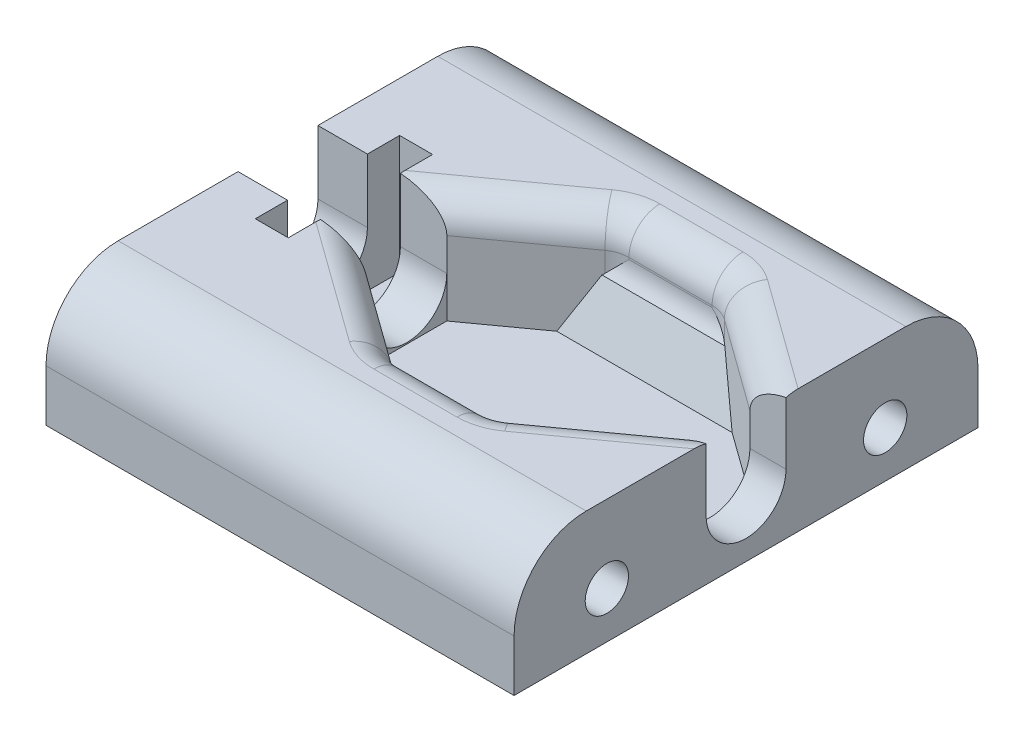
from build123d import *

# Parameters (mm, degrees)
SKETCH1_W                = 218
SKETCH1_H                = 45
BOSS_EXTRUDE1_DEPTH      = 42
SKETCH7_W                = 118.2
SKETCH7_H                = 42
CUT_EXTRUDE17_DEPTH      = 21
SKETCH4_W                = 7.75
SKETCH4_H                = 6.175
CUT_EXTRUDE14_DEPTH      = 97.8
SKETCH5_R                = 3.875
CUT_EXTRUDE15_DEPTH      = 97.8
SKETCH11_W               = 3.2
SKETCH11_H               = 14
CUT_EXTRUDE19_DEPTH      = 11.5
CUT_EXTRUDE43_DEPTH      = 7
SKETCH53_R               = 2.1
CUT_EXTRUDE44_DEPTH      = 95
SKETCH68_R               = 2.65
CUT_EXTRUDE57_DEPTH      = 28.3
BOSS_EXTRUDE2_DEPTH      = 5
SKETCH42_W               = 80.5
SKETCH42_H               = 9.5
BOSS_EXTRUDE3_DEPTH      = 35
SKETCH38_R               = 3.1
CUT_EXTRUDE32_DEPTH      = 4.7
SKETCH40_R               = 5.5
CUT_EXTRUDE34_DEPTH      = 9
SKETCH41_R               = 5.75
CUT_EXTRUDE35_DEPTH      = 4
FILLET1_R                = 7
FILLET7_R                = 5
SKETCH47_R               = 1.5
CUT_EXTRUDE39_DEPTH      = 7
SKETCH49_R               = 2.8
CUT_EXTRUDE41_DEPTH      = 33
SKETCH56_W               = 15.8
SKETCH56_H               = 10.4
CUT_EXTRUDE47_DEPTH      = 32.15
SKETCH57_W               = 5
SKETCH57_H               = 10.4
CUT_EXTRUDE48_DEPTH      = 15
SKETCH58_R               = 2.8
SKETCH58_R_2             = 2.05
CUT_EXTRUDE49_DEPTH      = 10
SKETCH59_R               = 1.5
SKETCH59_R_2             = 0.95
CUT_EXTRUDE50_DEPTH      = 6.5
CUT_EXTRUDE51_START      = -9
CUT_EXTRUDE51_DEPTH      = 9
CUT_EXTRUDE52_DEPTH      = 118.2
SKETCH64_R               = 1.5
CUT_EXTRUDE53_DEPTH      = 14
SKETCH65_R               = 2.8
CUT_EXTRUDE54_DEPTH      = 9.95
SKETCH66_R               = 1.5
CUT_EXTRUDE55_DEPTH      = 25
SKETCH67_R               = 1.45
CUT_EXTRUDE56_DEPTH      = 7
CUT_EXTRUDE58_START      = -4
SKETCH69_R               = 2.8
CUT_EXTRUDE58_DEPTH      = 41
CUT_EXTRUDE59_DEPTH      = 6.175
FILLET17_R               = 3
CUT_EXTRUDE64_DEPTH      = 4
FILLET19_R               = 3
CUT_EXTRUDE65_DEPTH      = 4
CUT_EXTRUDE61_DEPTH      = 1
CUT_EXTRUDE61_DEPTH_BACK = 221.034656475
SKETCH72_W               = 64
SKETCH72_H               = 35
SKETCH74_W               = 118.2
SKETCH74_H               = 64
CUT_EXTRUDE62_DEPTH      = 226.02944262
SKETCH81_W               = 45.4
SKETCH81_H               = 45
CUT_EXTRUDE66_DEPTH      = 12


with BuildPart() as part:
    # Sketch1 → Boss-Extrude1 (new body)
    with BuildSketch(Plane(origin=(0, 0, 0), x_dir=(1, 0, 0), z_dir=(0, 1, 0))):
        with Locations((109, 22.5)):
            Rectangle(SKETCH1_W, SKETCH1_H)
    extrude(amount=BOSS_EXTRUDE1_DEPTH)

    # Sketch7 → Cut-Extrude17 (cut)
    with BuildSketch(Plane(origin=(0, 42, 0), x_dir=(1, 0, 0), z_dir=(0, 1, 0))):
        with Locations((68.1, 22.5)):
            Rectangle(SKETCH7_W, SKETCH7_H)
    extrude(amount=-CUT_EXTRUDE17_DEPTH, mode=Mode.SUBTRACT)

    # Sketch4 → Cut-Extrude14 (cut)
    with BuildSketch(Plane(origin=(218, 0, 0), x_dir=(0, 0, -1), z_dir=(1, 0, 0))):
        with Locations((22.5, 38.9125)):
            Rectangle(SKETCH4_W, SKETCH4_H)
    extrude(amount=-CUT_EXTRUDE14_DEPTH, mode=Mode.SUBTRACT)

    # Sketch5 → Cut-Extrude15 (cut)
    with BuildSketch(Plane(origin=(218, 0, 0), x_dir=(0, 0, -1), z_dir=(1, 0, 0))):
        with Locations((22.5, 35.825)):
            Circle(SKETCH5_R)
    extrude(amount=-CUT_EXTRUDE15_DEPTH, mode=Mode.SUBTRACT)

    # Sketch11 → Cut-Extrude19 (cut)
    with BuildSketch(Plane(origin=(0, 42, 0), x_dir=(1, 0, 0), z_dir=(0, 1, 0))):
        with Locations((133.6, 22.5)):
            Rectangle(SKETCH11_W, SKETCH11_H)
    extrude(amount=-CUT_EXTRUDE19_DEPTH, mode=Mode.SUBTRACT)

    # Sketch52 → Cut-Extrude43 (cut)
    with BuildSketch(Plane(origin=(218, 0, 0), x_dir=(0, 0, -1), z_dir=(1, 0, 0))):
        with BuildLine():
            Line((17.475, 42), (17.475, 35.825))
            ThreePointArc((17.475, 35.825), (22.5, 30.8), (27.525, 35.825))
            Line((27.525, 35.825), (27.525, 42))
            Line((27.525, 42), (17.475, 42))
        make_face()
    extrude(amount=-CUT_EXTRUDE43_DEPTH, mode=Mode.SUBTRACT)

    # Sketch53 → Cut-Extrude44 (cut)
    with BuildSketch(Plane(origin=(218, 0, 0), x_dir=(0, 0, -1), z_dir=(1, 0, 0))):
        with Locations((9, 34.5)):
            Circle(SKETCH53_R)
        with Locations((36, 34.5)):
            Circle(SKETCH53_R)
    extrude(amount=-CUT_EXTRUDE44_DEPTH, mode=Mode.SUBTRACT)

    # Sketch68 → Cut-Extrude57 (cut)
    with BuildSketch(Plane.ZY.offset(-127.2)):
        with Locations((-9, 34.5)):
            Circle(SKETCH68_R)
        with Locations((-36, 34.5)):
            Circle(SKETCH68_R)
    extrude(amount=-CUT_EXTRUDE57_DEPTH, mode=Mode.SUBTRACT)

    # Sketch14 → Boss-Extrude2 (add)
    with BuildSketch(Plane.XZ):
        Polygon((9, -54.5), (89.5, -54.5), (89.5, -45), (218, -45), (218, 0), (89.5, 0), (89.5, 9.5), (9, 9.5), (9, 0), (0, 0), (0, -45), (9, -45), align=None)
    extrude(amount=BOSS_EXTRUDE2_DEPTH)

    # Sketch42 → Boss-Extrude3 (add)
    with BuildSketch(Plane(origin=(0, 0, 0), x_dir=(1, 0, 0), z_dir=(0, 1, 0))):
        with Locations((49.25, -4.75)):
            Rectangle(SKETCH42_W, SKETCH42_H)
        with Locations((49.25, 49.75)):
            Rectangle(SKETCH42_W, SKETCH42_H)
    extrude(amount=BOSS_EXTRUDE3_DEPTH)

    # Sketch38 → Cut-Extrude32 (cut)
    with BuildSketch(Plane(origin=(127.2, -5, -22.5), x_dir=(0, 0, -1), z_dir=(0, -1, 0))):
        with Locations((23.5, -61.2)):
            Circle(SKETCH38_R)
        with Locations((10, -61.2)):
            Circle(SKETCH38_R)
    extrude(amount=-CUT_EXTRUDE32_DEPTH, mode=Mode.SUBTRACT)

    # Sketch40 → Cut-Extrude34 (cut)
    with BuildSketch(Plane(origin=(127.2, -5, -22.5), x_dir=(0, 0, -1), z_dir=(0, -1, 0))):
        with Locations((0, -33.7)):
            Circle(SKETCH40_R)
    extrude(amount=-CUT_EXTRUDE34_DEPTH, mode=Mode.SUBTRACT)

    # Sketch41 → Cut-Extrude35 (cut)
    with BuildSketch(Plane(origin=(127.2, -5, -22.5), x_dir=(0, 0, -1), z_dir=(0, -1, 0))):
        with Locations((20, -73.2)):
            Circle(SKETCH41_R)
        with Locations((-20, -73.2)):
            Circle(SKETCH41_R)
    extrude(amount=-CUT_EXTRUDE35_DEPTH, mode=Mode.SUBTRACT)

    # Fillet1
    # the kernel refuses this fillet: 7 mm, written as the material it takes off along each edge
    with BuildSketch(Plane(origin=(235.5, 42, -45), x_dir=(0, 0, 1), z_dir=(-1, 0, 0))) as fillet1_piece_1:
        with BuildLine():
            CenterArc((FILLET1_R, -FILLET1_R), FILLET1_R, 90, 90)
            Line((0, -FILLET1_R), (0, 0))
            Line((0, 0), (FILLET1_R, 0))
        make_face()
    extrude(amount=253, mode=Mode.SUBTRACT)
    with BuildSketch(Plane(origin=(-17.5, 42, 0), x_dir=(0, -1, 0), z_dir=(1, 0, 0))) as fillet1_piece_2:
        with BuildLine():
            CenterArc((FILLET1_R, FILLET1_R), FILLET1_R, 180, 90)
            Line((0, FILLET1_R), (0, 0))
            Line((0, 0), (FILLET1_R, 0))
        make_face()
    extrude(amount=253, mode=Mode.SUBTRACT)

    # Fillet7
    fillet7_edges = [part.edges().sort_by_distance(p)[0] for p in [
        (49.25, 35, -54.5),
        (49.25, 35, 9.5),
    ]]
    fillet(fillet7_edges, radius=FILLET7_R)

    # Sketch47 → Cut-Extrude39 (cut)
    with BuildSketch(Plane(origin=(127.2, -0.3, -22.5), x_dir=(0, 0, -1), z_dir=(0, -1, 0))):
        with Locations((23.5, -61.2)):
            Circle(SKETCH47_R)
        with Locations((10, -61.2)):
            Circle(SKETCH47_R)
    extrude(amount=-CUT_EXTRUDE39_DEPTH, mode=Mode.SUBTRACT)

    # Sketch49 → Cut-Extrude41 (cut)
    with BuildSketch(Plane.XZ.offset(-6.7)):
        with Locations(Location((66, -32.5, 0), (0, 0, 270))):
            Circle(SKETCH49_R)
        with Locations(Location((66, -46, 0), (0, 0, 270))):
            Circle(SKETCH49_R)
    extrude(amount=-CUT_EXTRUDE41_DEPTH, mode=Mode.SUBTRACT)

    # Sketch56 → Cut-Extrude47 (cut)
    with BuildSketch(Plane.XZ.offset(5)):
        with Locations((135.1, -14.2)):
            Rectangle(SKETCH56_W, SKETCH56_H)
    extrude(amount=-CUT_EXTRUDE47_DEPTH, mode=Mode.SUBTRACT)

    # Sketch57 → Cut-Extrude48 (cut)
    with BuildSketch(Plane.XZ.offset(5)):
        with Locations((124.7, -14.2)):
            Rectangle(SKETCH57_W, SKETCH57_H)
    extrude(amount=-CUT_EXTRUDE48_DEPTH, mode=Mode.SUBTRACT)

    # Sketch58 → Cut-Extrude49 (cut)
    with BuildSketch(Plane(origin=(127.2, 21, 0), x_dir=(0, -1, 0), z_dir=(0, 0, 1))):
        with Locations(Location((19.05, 2.8, 0), (0, 0, 90))):
            Circle(SKETCH58_R)
        with Locations(Location((10.15, 2.8, 0), (0, 0, 90))):
            Circle(SKETCH58_R_2)
        with BuildLine():
            Line((-2.632795978, 15.65), (-3.667204022, 15.65))
            ThreePointArc((-3.667204022, 15.65), (-5.85, 13), (-3.667204022, 10.35))
            Line((-3.667204022, 10.35), (-2.632795978, 10.35))
            ThreePointArc((-2.632795978, 10.35), (-0.45, 13), (-2.632795978, 15.65))
        make_face()
    extrude(amount=-CUT_EXTRUDE49_DEPTH, mode=Mode.SUBTRACT)

    # Sketch59 → Cut-Extrude50 (cut)
    with BuildSketch(Plane.XY.offset(-19.4)):
        with Locations((130, 1.95)):
            Circle(SKETCH59_R)
        with Locations((130, 10.85)):
            Circle(SKETCH59_R_2)
        with Locations((140.2, 24.15)):
            Circle(SKETCH59_R)
    extrude(amount=-CUT_EXTRUDE50_DEPTH, mode=Mode.SUBTRACT)

    # Sketch62 → Cut-Extrude51 (cut)
    with BuildSketch(Plane.ZY.offset(CUT_EXTRUDE51_START)):
        with BuildLine():
            Line((0, -5), (-45, -5))
            Line((-45, -5), (-45, 35))
            ThreePointArc((-45, 35), (-42.949747468, 39.949747468), (-38, 42))
            Line((-38, 42), (-7, 42))
            ThreePointArc((-7, 42), (-2.050252532, 39.949747468), (0, 35))
            Line((0, 35), (0, -5))
        make_face()
    extrude(amount=CUT_EXTRUDE51_DEPTH, mode=Mode.SUBTRACT)

    # Sketch63 → Cut-Extrude52 (cut)
    with BuildSketch(Plane(origin=(127.2, 21, -22.5), x_dir=(0, 0, -1), z_dir=(-1, 0, 0))):
        with BuildLine():
            Line((-10.959716831, -18.950283169), (11.040283169, -18.950283169))
            ThreePointArc((11.040283169, -18.950283169), (18.111350981, -16.021350981), (21.040283169, -8.950283169))
            Line((21.040283169, -8.950283169), (21.040283169, 2.049716831))
            ThreePointArc((21.040283169, 2.049716831), (18.111350981, 9.120784643), (11.040283169, 12.049716831))
            Line((11.040283169, 12.049716831), (-10.959716831, 12.049716831))
            ThreePointArc((-10.959716831, 12.049716831), (-18.030784643, 9.120784643), (-20.959716831, 2.049716831))
            Line((-20.959716831, 2.049716831), (-20.959716831, -8.950283169))
            ThreePointArc((-20.959716831, -8.950283169), (-18.030784643, -16.021350981), (-10.959716831, -18.950283169))
        make_face()
    extrude(amount=CUT_EXTRUDE52_DEPTH, mode=Mode.SUBTRACT)

    # Sketch64 → Cut-Extrude53 (cut)
    with BuildSketch(Plane(origin=(127.2, -5, -22.5), x_dir=(0, 0, -1), z_dir=(0, -1, 0))):
        with Locations((-1, -71.2)):
            Circle(SKETCH64_R)
    extrude(amount=-CUT_EXTRUDE53_DEPTH, mode=Mode.SUBTRACT)

    # Sketch65 → Cut-Extrude54 (cut)
    with BuildSketch(Plane(origin=(127.2, 8.950283169, -22.5), x_dir=(0, 0, 1), z_dir=(0, 1, 0))):
        with Locations((1, -71.2)):
            Circle(SKETCH65_R)
    extrude(amount=-CUT_EXTRUDE54_DEPTH, mode=Mode.SUBTRACT)

    # Sketch66 → Cut-Extrude55 (cut)
    with BuildSketch(Plane(origin=(127.2, -5, -22.5), x_dir=(0, 0, -1), z_dir=(0, -1, 0))):
        with Locations((-20, -52.2)):
            Circle(SKETCH66_R)
    extrude(amount=-CUT_EXTRUDE55_DEPTH, mode=Mode.SUBTRACT)

    # Sketch67 → Cut-Extrude56 (cut)
    with BuildSketch(Plane(origin=(9, 21, -22.5), x_dir=(0, 0, -1), z_dir=(-1, 0, 0))):
        with Locations(Location((27, -9, 0), (0, 0, 180))):
            Circle(SKETCH67_R)
        with Locations(Location((27, 21, 0), (0, 0, 180))):
            Circle(SKETCH67_R)
        with Locations(Location((-27, 21, 0), (0, 0, 180))):
            Circle(SKETCH67_R)
        with Locations(Location((-27, -9, 0), (0, 0, 180))):
            Circle(SKETCH67_R)
    extrude(amount=-CUT_EXTRUDE56_DEPTH, mode=Mode.SUBTRACT)

    # Sketch69 → Cut-Extrude58 (cut)
    with BuildSketch(Plane(origin=(127.2, -5, -22.5), x_dir=(0, 0, -1), z_dir=(0, -1, 0)).offset(CUT_EXTRUDE58_START)):
        with Locations((-20, -52.2)):
            Circle(SKETCH69_R)
    extrude(amount=-CUT_EXTRUDE58_DEPTH, mode=Mode.SUBTRACT)

    # Sketch70 → Cut-Extrude59 (cut)
    with BuildSketch(Plane(origin=(0, 42, 0), x_dir=(1, 0, 0), z_dir=(0, 1, 0))):
        Polygon((149.4, 33.375), (159.4, 33.375), (169.1, 26.375), (139.7, 26.375), align=None)
        Polygon((177.1, 26.375), (186.8, 33.375), (196.8, 33.375), (206.5, 26.375), align=None)
        Polygon((139.7, 18.625), (149.4, 11.625), (159.4, 11.625), (169.1, 18.625), align=None)
        Polygon((177.1, 18.625), (186.8, 11.625), (196.8, 11.625), (206.5, 18.625), align=None)
    extrude(amount=-CUT_EXTRUDE59_DEPTH, mode=Mode.SUBTRACT)

    # Fillet17
    fillet17_edges = [part.edges().sort_by_distance(p)[0] for p in [
        (154.4, 35.825, -11.625),
        (159.4, 38.9125, -11.625),
        (149.4, 38.9125, -11.625),
        (144.55, 42, -15.125),
        (154.4, 42, -11.625),
        (164.25, 42, -15.125),
        (154.4, 35.825, -33.375),
        (149.4, 38.9125, -33.375),
        (159.4, 38.9125, -33.375),
        (164.25, 42, -29.875),
        (154.4, 42, -33.375),
        (144.55, 42, -29.875),
    ]]
    fillet(fillet17_edges, radius=FILLET17_R)

    # Sketch78 → Cut-Extrude64 (cut)
    with BuildSketch(Plane(origin=(0, 35.825, 0), x_dir=(1, 0, 0), z_dir=(0, 1, 0))):
        Polygon((145.242857143, 30.375), (163.557142857, 30.375), (169.1, 26.375), (169.1, 18.625), (163.557142857, 14.625), (145.242857143, 14.625), (139.7, 18.625), (139.7, 26.375), align=None)
    extrude(amount=-CUT_EXTRUDE64_DEPTH, mode=Mode.SUBTRACT)

    # Fillet19
    # the kernel refuses this fillet: 3 mm, written as the material it adds along each edge
    with BuildSketch(Plane(origin=(186.8, 42, -11.625), x_dir=(-0.8108996116451952, 0, -0.5851852867542652), z_dir=(0, -1, 0)), Plane(origin=(196.8, 42, -11.625), x_dir=(-1, 0, 0), z_dir=(0, -1, 0))) as fillet19_piece_1:
        with BuildLine():
            CenterArc((FILLET19_R * 0.323146177177, FILLET19_R), FILLET19_R, 234.183919251, 35.816080749)
            Line((-FILLET19_R * 0.262039109577, FILLET19_R * 0.189100388355), (0, 0))
            Line((0, 0), (FILLET19_R * 0.323146177177, 0))
        make_face()
    extrude(amount=8.598596329)
    with BuildSketch(Plane(origin=(179.3, 35.825, -11.625), x_dir=(0, 1, 0), z_dir=(1, 0, 0))) as fillet19_piece_2:
        with BuildLine():
            CenterArc((FILLET19_R, -FILLET19_R), FILLET19_R, 90, 90)
            Line((0, -FILLET19_R), (0, 0))
            Line((0, 0), (FILLET19_R, 0))
        make_face()
    extrude(amount=25)
    with BuildSketch(Plane(origin=(196.8, 42, -33.375), x_dir=(-1, 0, 0), z_dir=(0, -1, 0)), Plane(origin=(186.8, 42, -33.375), x_dir=(-0.8108996116451974, 0, 0.5851852867542621), z_dir=(0, -1, 0))) as fillet19_piece_3:
        with BuildLine():
            CenterArc((FILLET19_R * 0.323146177177, -FILLET19_R), FILLET19_R, 90, 35.816080749)
            Line((-FILLET19_R * 0.262039109577, -FILLET19_R * 0.189100388355), (0, 0))
            Line((0, 0), (FILLET19_R * 0.323146177177, 0))
        make_face()
    extrude(amount=8.598596329)
    with BuildSketch(Plane(origin=(179.3, 35.825, -33.375), x_dir=(0, 1, 0), z_dir=(1, 0, 0))) as fillet19_piece_4:
        with BuildLine():
            CenterArc((FILLET19_R, FILLET19_R), FILLET19_R, 180, 90)
            Line((0, FILLET19_R), (0, 0))
            Line((0, 0), (FILLET19_R, 0))
        make_face()
    extrude(amount=25)
    # the kernel refuses this fillet: 3 mm, written as the material it takes off along each edge
    with BuildSketch(Plane(origin=(171.018252913, 42, -23.013889651), x_dir=(-0.5851852867542667, 0, 0.8108996116451942), z_dir=(0.8108996116451941, 0, 0.5851852867542667)), Plane(origin=(197.586117329, 42, -12.192301165), x_dir=(0.5851852867542677, 0, 0.8108996116451934), z_dir=(0.8108996116451934, 0, -0.5851852867542677))) as fillet19_2_piece_1:
        with BuildLine():
            CenterArc((FILLET19_R, FILLET19_R), FILLET19_R, 180, 90)
            Line((0, FILLET19_R), (0, 0))
            Line((0, 0), (FILLET19_R, 0))
        make_face()
    extrude(amount=18.492584709, mode=Mode.SUBTRACT)
    with BuildSketch(Plane(origin=(197.586117329, 42, -32.807698835), x_dir=(0.585185286754268, 0, -0.8108996116451932), z_dir=(0.8108996116451932, 0, 0.585185286754268)), Plane(origin=(171.018252913, 42, -21.986110349), x_dir=(-0.5851852867542668, 0, -0.810899611645194), z_dir=(0.8108996116451941, 0, -0.5851852867542668))) as fillet19_2_piece_2:
        with BuildLine():
            CenterArc((FILLET19_R, -FILLET19_R), FILLET19_R, 90, 90)
            Line((0, -FILLET19_R), (0, 0))
            Line((0, 0), (FILLET19_R, 0))
        make_face()
    extrude(amount=18.492584709, mode=Mode.SUBTRACT)
    with BuildSketch(Plane(origin=(187.769438532, 42, -11.625), x_dir=(0, 0, 1), z_dir=(1, 0, 0))) as fillet19_2_piece_3:
        with BuildLine():
            CenterArc((FILLET19_R, FILLET19_R), FILLET19_R, 180, 90)
            Line((0, FILLET19_R), (0, 0))
            Line((0, 0), (FILLET19_R, 0))
        make_face()
    extrude(amount=8.061122937, mode=Mode.SUBTRACT)
    with BuildSketch(Plane(origin=(187.769438532, 42, -33.375), x_dir=(0, 0, -1), z_dir=(1, 0, 0))) as fillet19_2_piece_4:
        with BuildLine():
            CenterArc((FILLET19_R, -FILLET19_R), FILLET19_R, 90, 90)
            Line((0, -FILLET19_R), (0, 0))
            Line((0, 0), (FILLET19_R, 0))
        make_face()
    extrude(amount=8.061122937, mode=Mode.SUBTRACT)
    with BuildSketch(Plane(origin=(187.769438532, 42, -30.375), x_dir=(-0.5851852867542677, 0, -0.8108996116451933), z_dir=(-0.8108996116451933, 0, 0.5851852867542677))) as fillet19_2_piece_5:
        with BuildLine():
            CenterArc((3 + FILLET19_R, FILLET19_R), FILLET19_R, 180, 90)
            Line((3, FILLET19_R), (3, 0))
            Line((3, 0), (3 + FILLET19_R, 0))
        make_face()
    revolve(axis=Axis((187.769438532, 42, -30.375), (0, -1, 0)), revolution_arc=35.816080749, mode=Mode.SUBTRACT)
    with BuildSketch(Plane(origin=(195.830561468, 42, -30.375), x_dir=(0, 0, -1), z_dir=(-1, 0, 0))) as fillet19_2_piece_6:
        with BuildLine():
            CenterArc((3 + FILLET19_R, FILLET19_R), FILLET19_R, 180, 90)
            Line((3, FILLET19_R), (3, 0))
            Line((3, 0), (3 + FILLET19_R, 0))
        make_face()
    revolve(axis=Axis((195.830561468, 42, -30.375), (0, -1, 0)), revolution_arc=35.816080749, mode=Mode.SUBTRACT)
    with BuildSketch(Plane(origin=(187.769438532, 42, -14.625), x_dir=(-0.5851852867542673, 0, 0.8108996116451938), z_dir=(-0.8108996116451938, 0, -0.5851852867542673))) as fillet19_2_piece_7:
        with BuildLine():
            CenterArc((3 + FILLET19_R, -FILLET19_R), FILLET19_R, 90, 90)
            Line((3, -FILLET19_R), (3, 0))
            Line((3, 0), (3 + FILLET19_R, 0))
        make_face()
    revolve(axis=Axis((187.769438532, 42, -14.625), (0, 1, 0)), revolution_arc=35.816080749, mode=Mode.SUBTRACT)
    with BuildSketch(Plane(origin=(195.830561468, 42, -14.625), x_dir=(0, 0, 1), z_dir=(-1, 0, 0))) as fillet19_2_piece_8:
        with BuildLine():
            CenterArc((3 + FILLET19_R, -FILLET19_R), FILLET19_R, 90, 90)
            Line((3, -FILLET19_R), (3, 0))
            Line((3, 0), (3 + FILLET19_R, 0))
        make_face()
    revolve(axis=Axis((195.830561468, 42, -14.625), (0, 1, 0)), revolution_arc=35.816080749, mode=Mode.SUBTRACT)

    # Sketch79 → Cut-Extrude65 (cut)
    with BuildSketch(Plane(origin=(0, 35.825, 0), x_dir=(1, 0, 0), z_dir=(0, 1, 0))):
        Polygon((182.642857143, 30.375), (177.1, 26.375), (177.1, 18.625), (182.642857143, 14.625), (200.957142857, 14.625), (206.5, 18.625), (206.5, 26.375), (200.957142857, 30.375), align=None)
    extrude(amount=-CUT_EXTRUDE65_DEPTH, mode=Mode.SUBTRACT)

    # Chamfer1
    # the kernel refuses this chamfer: 10 mm, written as the material it takes off along each edge
    with BuildSketch(Plane(origin=(168.431697314, 35.825, -30.375), x_dir=(0, 0.5127284623875434, -0.8585508277660127), z_dir=(1, 0, 0))) as chamfer1_piece_1_section:
        with BuildLine():
            Line((2.846151297, 0), (-3.030407819, -4.809340769))
            Line((-3.030407819, -4.809340769), (-3.202117985, -4.706795077))
            ThreePointArc((-3.202117985, -4.706795077), (-1.628587032, -2.336957732), (-0.171710166, 0.102545692))
            Line((-0.171710166, 0.102545692), (0.102545692, 0.171710166))
            ThreePointArc((0.102545692, 0.171710166), (1.413174006, -0.221555438), (2.779590285, 0.188599129))
            Line((2.779590285, 0.188599129), (2.846151297, 0))
        make_face()
    chamfer1_piece_1 = extrude(amount=46.736605371, mode=Mode.PRIVATE)
    chamfer1_piece_1 = split(chamfer1_piece_1, bisect_by=Plane(origin=(188.974245231, 34.450110824, -34.94404295), z_dir=(0.5851852867542668, 0, 0.8108996116451941)), keep=Keep.TOP, mode=Mode.PRIVATE)
    chamfer1_piece_1 = split(chamfer1_piece_1, bisect_by=Plane(origin=(194.625754769, 34.450110824, -34.94404295), z_dir=(-0.585185286754268, 0, 0.8108996116451932)), keep=Keep.TOP, mode=Mode.PRIVATE)
    chamfer1_piece_1 = split(chamfer1_piece_1, bisect_by=Plane(origin=(191.8, 31.825, -31.028354199), z_dir=(0, 1, 0)), keep=Keep.TOP, mode=Mode.PRIVATE)
    add(chamfer1_piece_1, mode=Mode.SUBTRACT)
    with BuildSketch(Plane(origin=(131.031697314, 35.825, -30.375), x_dir=(0, 0.5127284623875334, -0.8585508277660184), z_dir=(1, 0, 0))) as chamfer1_piece_2_section:
        with BuildLine():
            Line((2.846151297, 0), (-3.030407819, -4.809340769))
            Line((-3.030407819, -4.809340769), (-3.202117985, -4.706795077))
            ThreePointArc((-3.202117985, -4.706795077), (-1.628587032, -2.336957732), (-0.171710166, 0.102545692))
            Line((-0.171710166, 0.102545692), (0.102545692, 0.171710166))
            ThreePointArc((0.102545692, 0.171710166), (1.413174006, -0.221555438), (2.779590285, 0.188599129))
            Line((2.779590285, 0.188599129), (2.846151297, 0))
        make_face()
    chamfer1_piece_2 = extrude(amount=46.736605371, mode=Mode.PRIVATE)
    chamfer1_piece_2 = split(chamfer1_piece_2, bisect_by=Plane(origin=(157.225754769, 34.450110824, -34.94404295), z_dir=(-0.5851852867542653, 0, 0.8108996116451952)), keep=Keep.TOP, mode=Mode.PRIVATE)
    chamfer1_piece_2 = split(chamfer1_piece_2, bisect_by=Plane(origin=(151.574245231, 34.450110824, -34.94404295), z_dir=(0.5851852867542653, 0, 0.8108996116451952)), keep=Keep.TOP, mode=Mode.PRIVATE)
    chamfer1_piece_2 = split(chamfer1_piece_2, bisect_by=Plane(origin=(154.4, 31.825, -31.028354199), z_dir=(0, 1, 0)), keep=Keep.TOP, mode=Mode.PRIVATE)
    add(chamfer1_piece_2, mode=Mode.SUBTRACT)

    # Chamfer2
    # the kernel refuses this chamfer: 10 mm, written as the material it takes off along each edge
    with BuildSketch(Plane(origin=(168.431697314, 35.825, -14.625), x_dir=(0, 0.5127284623875406, 0.8585508277660144), z_dir=(1, 0, 0))) as chamfer2_piece_1_section:
        with BuildLine():
            Line((2.846151297, 0), (-3.030407819, 4.809340769))
            Line((-3.030407819, 4.809340769), (-3.202117985, 4.706795077))
            ThreePointArc((-3.202117985, 4.706795077), (-1.628587032, 2.336957732), (-0.171710166, -0.102545692))
            Line((-0.171710166, -0.102545692), (0.102545692, -0.171710166))
            ThreePointArc((0.102545692, -0.171710166), (1.413174006, 0.221555438), (2.779590285, -0.188599129))
            Line((2.779590285, -0.188599129), (2.846151297, 0))
        make_face()
    chamfer2_piece_1 = extrude(amount=46.736605371, mode=Mode.PRIVATE)
    chamfer2_piece_1 = split(chamfer2_piece_1, bisect_by=Plane(origin=(191.8, 31.825, -13.971645801), z_dir=(0, 1, 0)), keep=Keep.TOP, mode=Mode.PRIVATE)
    chamfer2_piece_1 = split(chamfer2_piece_1, bisect_by=Plane(origin=(188.974245231, 34.450110824, -10.05595705), z_dir=(0.5851852867542655, 0, -0.8108996116451951)), keep=Keep.TOP, mode=Mode.PRIVATE)
    chamfer2_piece_1 = split(chamfer2_piece_1, bisect_by=Plane(origin=(194.625754769, 34.450110824, -10.05595705), z_dir=(-0.5851852867542667, 0, -0.8108996116451941)), keep=Keep.TOP, mode=Mode.PRIVATE)
    add(chamfer2_piece_1, mode=Mode.SUBTRACT)
    with BuildSketch(Plane(origin=(131.031697314, 35.825, -14.625), x_dir=(0, 0.512728462387533, 0.8585508277660189), z_dir=(1, 0, 0))) as chamfer2_piece_2_section:
        with BuildLine():
            Line((2.846151297, 0), (-3.030407819, 4.809340769))
            Line((-3.030407819, 4.809340769), (-3.202117985, 4.706795077))
            ThreePointArc((-3.202117985, 4.706795077), (-1.628587032, 2.336957732), (-0.171710166, -0.102545692))
            Line((-0.171710166, -0.102545692), (0.102545692, -0.171710166))
            ThreePointArc((0.102545692, -0.171710166), (1.413174006, 0.221555438), (2.779590285, -0.188599129))
            Line((2.779590285, -0.188599129), (2.846151297, 0))
        make_face()
    chamfer2_piece_2 = extrude(amount=46.736605371, mode=Mode.PRIVATE)
    chamfer2_piece_2 = split(chamfer2_piece_2, bisect_by=Plane(origin=(151.574245231, 34.450110824, -10.05595705), z_dir=(0.5851852867542657, 0, -0.810899611645195)), keep=Keep.TOP, mode=Mode.PRIVATE)
    chamfer2_piece_2 = split(chamfer2_piece_2, bisect_by=Plane(origin=(157.225754769, 34.450110824, -10.05595705), z_dir=(-0.5851852867542657, 0, -0.810899611645195)), keep=Keep.TOP, mode=Mode.PRIVATE)
    chamfer2_piece_2 = split(chamfer2_piece_2, bisect_by=Plane(origin=(154.4, 31.825, -13.971645801), z_dir=(0, 1, 0)), keep=Keep.TOP, mode=Mode.PRIVATE)
    add(chamfer2_piece_2, mode=Mode.SUBTRACT)

    # Sketch72 → Cut-Extrude61 (cut, two sides: drawn at the far end of the back side and taken through both)
    with BuildSketch(Plane.ZY.offset(-9).offset(-CUT_EXTRUDE61_DEPTH_BACK)):
        with Locations((-22.5, 12.5)):
            Rectangle(SKETCH72_W, SKETCH72_H)
    extrude(amount=CUT_EXTRUDE61_DEPTH + CUT_EXTRUDE61_DEPTH_BACK, mode=Mode.SUBTRACT)

    # Sketch74 → Cut-Extrude62 (cut, through all)
    with BuildSketch(Plane.XZ.offset(-30)):
        with Locations((68.1, -22.5)):
            Rectangle(SKETCH74_W, SKETCH74_H)
    extrude(amount=-CUT_EXTRUDE62_DEPTH, mode=Mode.SUBTRACT)

    # Sketch81 → Cut-Extrude66 (cut)
    with BuildSketch(Plane(origin=(0, 42, 0), x_dir=(1, 0, 0), z_dir=(0, 1, 0))):
        with Locations((195.3, 22.5)):
            Rectangle(SKETCH81_W, SKETCH81_H)
    extrude(amount=-CUT_EXTRUDE66_DEPTH, mode=Mode.SUBTRACT)


solid = part.part
